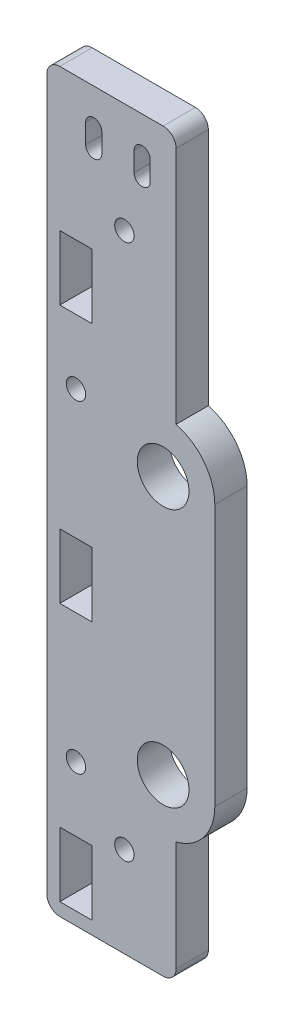
from build123d import *

# Parameters (mm, degrees)
SKETCH1_W           = 24
SKETCH1_H           = 110
SKETCH1_R           = 4
SKETCH1_R_2         = 1.5
BOSS_EXTRUDE1_DEPTH = 5
SKETCH2_W           = 6
SKETCH2_H           = 37
SKETCH2_H_2         = 17
CUT_EXTRUDE1_DEPTH  = 113.698713391
BOSS_EXTRUDE2_DEPTH = 5
SKETCH4_R           = 1.5
SKETCH4_W           = 5
SKETCH4_H           = 10
CUT_EXTRUDE2_DEPTH  = 115.651646303
FILLET1_R           = 2
FILLET2_R           = 8


with BuildPart() as part:
    # Sketch1 → Boss-Extrude1 (new body)
    with BuildSketch(Plane.XY):
        with Locations((12, 55)):
            Rectangle(SKETCH1_W, SKETCH1_H)
        with Locations((16, 65)):
            Circle(SKETCH1_R, mode=Mode.SUBTRACT)
        with Locations((16, 25)):
            Circle(SKETCH1_R, mode=Mode.SUBTRACT)
        with Locations((10, 12)):
            Circle(SKETCH1_R_2, mode=Mode.SUBTRACT)
        with Locations((10, 95)):
            Circle(SKETCH1_R_2, mode=Mode.SUBTRACT)
        with BuildLine():
            Line((4, 103.5), (4, 106.5))
            ThreePointArc((4, 106.5), (5.25, 107.75), (6.5, 106.5))
            Line((6.5, 106.5), (6.5, 103.5))
            ThreePointArc((6.5, 103.5), (5.25, 102.25), (4, 103.5))
        make_face(mode=Mode.SUBTRACT)
        with BuildLine():
            Line((11.5, 103.5), (11.5, 106.5))
            ThreePointArc((11.5, 106.5), (12.75, 107.75), (14, 106.5))
            Line((14, 106.5), (14, 103.5))
            ThreePointArc((14, 103.5), (12.75, 102.25), (11.5, 103.5))
        make_face(mode=Mode.SUBTRACT)
    extrude(amount=BOSS_EXTRUDE1_DEPTH)

    # Sketch2 → Cut-Extrude1 (cut, through all)
    with BuildSketch(Plane.XY.offset(5)):
        with Locations((21, 91.5)):
            Rectangle(SKETCH2_W, SKETCH2_H)
        with Locations((21, 8.5)):
            Rectangle(SKETCH2_W, SKETCH2_H_2)
    extrude(amount=-CUT_EXTRUDE1_DEPTH, mode=Mode.SUBTRACT)

    # Sketch3 → Boss-Extrude2 (add)
    with BuildSketch(Plane.XY.offset(5)):
        Polygon((18, -2), (18, 0), (0, 0), (0, 110), (18, 110), (18, 112), (-2, 112), (-2, -2), align=None)
    extrude(amount=-BOSS_EXTRUDE2_DEPTH)

    # Sketch4 → Cut-Extrude2 (cut, through all)
    with BuildSketch(Plane.XY.offset(5)):
        with Locations((2.5, 20)):
            Circle(SKETCH4_R)
        with Locations((2.5, 70)):
            Circle(SKETCH4_R)
        with Locations((2.5, 5)):
            Rectangle(SKETCH4_W, SKETCH4_H)
        with Locations((2.5, 85)):
            Rectangle(SKETCH4_W, SKETCH4_H)
        with Locations((2.5, 45)):
            Rectangle(SKETCH4_W, SKETCH4_H)
    extrude(amount=-CUT_EXTRUDE2_DEPTH, mode=Mode.SUBTRACT)

    # Fillet1
    fillet1_edges = [part.edges().sort_by_distance(p)[0] for p in [
        (18, 112, 2.5),
        (-2, 112, 2.5),
        (-2, -2, 2.5),
        (18, -2, 2.5),
    ]]
    fillet(fillet1_edges, radius=FILLET1_R)

    # Fillet2
    # the kernel refuses this fillet: 8 mm, written as the material it takes off along each edge
    with BuildSketch(Plane(origin=(24, 17, 24.364916731), x_dir=(0, 1, 0), z_dir=(0, 0, -1))) as fillet2_piece_1:
        with BuildLine():
            CenterArc((7.745966692, -8), FILLET2_R, 90, 75.522487814)
            Line((0, -6), (-0.154919334, -5.96))
            ThreePointArc((-0.154919334, -5.96), (-0.16, -3), (-0.16, 0))
            Line((-0.16, 0), (0, 0.16))
            Line((0, 0.16), (7.745966692, 0.16))
            Line((7.745966692, 0.16), (7.745966692, 0))
        make_face()
    extrude(amount=43.729833462, mode=Mode.SUBTRACT)
    with BuildSketch(Plane(origin=(24, 73, 24.364916731), x_dir=(-1, 0, 0), z_dir=(0, 0, -1))) as fillet2_piece_2:
        with BuildLine():
            CenterArc((8, -7.745966692), FILLET2_R, 104.477512186, 75.522487814)
            Line((0, -7.745966692), (-0.16, -7.745966692))
            Line((-0.16, -7.745966692), (-0.16, 0))
            Line((-0.16, 0), (0, 0.16))
            ThreePointArc((0, 0.16), (3, 0.16), (5.96, 0.154919334))
            Line((5.96, 0.154919334), (6, 0))
        make_face()
    extrude(amount=43.729833462, mode=Mode.SUBTRACT)


solid = part.part
